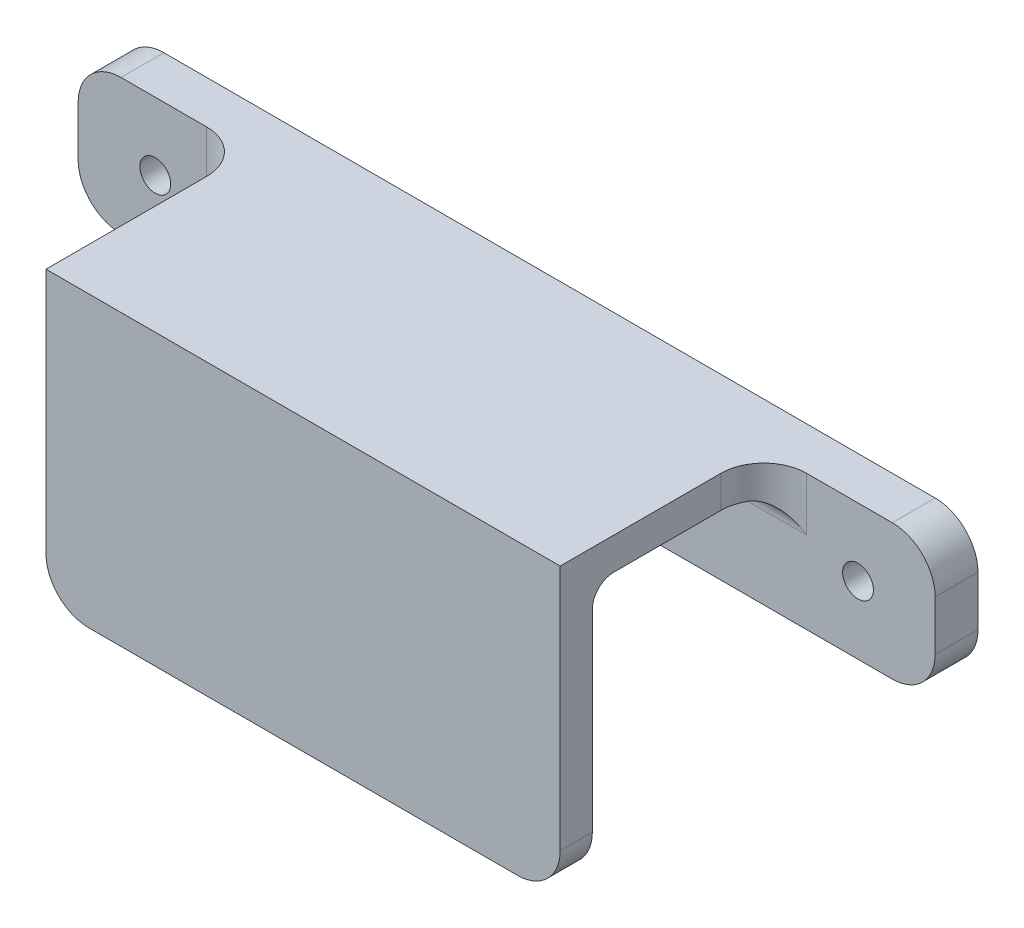
from build123d import *

# Parameters (mm, degrees)
SKETCH1_W           = 127
SKETCH1_H           = 20.066
BOSS_EXTRUDE1_DEPTH = 6.35
SKETCH2_W           = 76.2
SKETCH2_H           = 4.7625
BOSS_EXTRUDE2_DEPTH = 25.4
SKETCH4_W           = 76.2
SKETCH4_H           = 42.8625
BOSS_EXTRUDE3_DEPTH = 4.7625
SKETCH6_R           = 2.286
CUT_EXTRUDE1_DEPTH  = 81.269475683
FILLET1_R           = 6.35
FILLET5_R           = 6.35
FILLET6_R           = 3.175
FILLET7_R           = 6.35


with BuildPart() as part:
    # Sketch1 → Boss-Extrude1 (new body)
    with BuildSketch(Plane.XY):
        Rectangle(SKETCH1_W, SKETCH1_H)
    extrude(amount=BOSS_EXTRUDE1_DEPTH)

    # Sketch2 → Boss-Extrude2 (add)
    with BuildSketch(Plane.XY.offset(6.35)):
        with Locations((0, 7.65175)):
            Rectangle(SKETCH2_W, SKETCH2_H)
    extrude(amount=BOSS_EXTRUDE2_DEPTH)

    # Sketch4 → Boss-Extrude3 (add)
    with BuildSketch(Plane.XY.offset(31.75)):
        with Locations((0, -11.39825)):
            Rectangle(SKETCH4_W, SKETCH4_H)
    extrude(amount=BOSS_EXTRUDE3_DEPTH)

    # Sketch6 → Cut-Extrude1 (cut, through all)
    with BuildSketch(Plane(origin=(0, 0, 0), x_dir=(-1, 0, 0), z_dir=(0, 0, -1))):
        with Locations((-52.07, 0)):
            Circle(SKETCH6_R)
        with Locations((52.07, 0)):
            Circle(SKETCH6_R)
    extrude(amount=-CUT_EXTRUDE1_DEPTH, mode=Mode.SUBTRACT)

    # Fillet1
    fillet1_edges = [part.edges().sort_by_distance(p)[0] for p in [
        (-63.5, 10.033, 3.175),
        (-63.5, -10.033, 3.175),
        (63.5, -10.033, 3.175),
        (63.5, 10.033, 3.175),
    ]]
    fillet(fillet1_edges, radius=FILLET1_R)

    # Fillet5
    fillet5_edges = [part.edges().sort_by_distance(p)[0] for p in [
        (-38.1, -32.8295, 34.13125),
        (38.1, -32.8295, 34.13125),
    ]]
    fillet(fillet5_edges, radius=FILLET5_R)

    # Fillet6
    fillet6_edges = [part.edges().sort_by_distance(p)[0] for p in [
        (0, 5.2705, 6.35),
        (0, 5.2705, 31.75),
    ]]
    fillet(fillet6_edges, radius=FILLET6_R)

    # Fillet7
    fillet7_edges = [part.edges().sort_by_distance(p)[0] for p in [
        (-38.1, 6.06425, 6.35),
    ]]
    fillet(fillet7_edges, radius=FILLET7_R)
    fillet7_2_edges = [part.edges().sort_by_distance(p)[0] for p in [
        (38.1, 6.06425, 6.35),
    ]]
    fillet(fillet7_2_edges, radius=FILLET7_R)


solid = part.part
